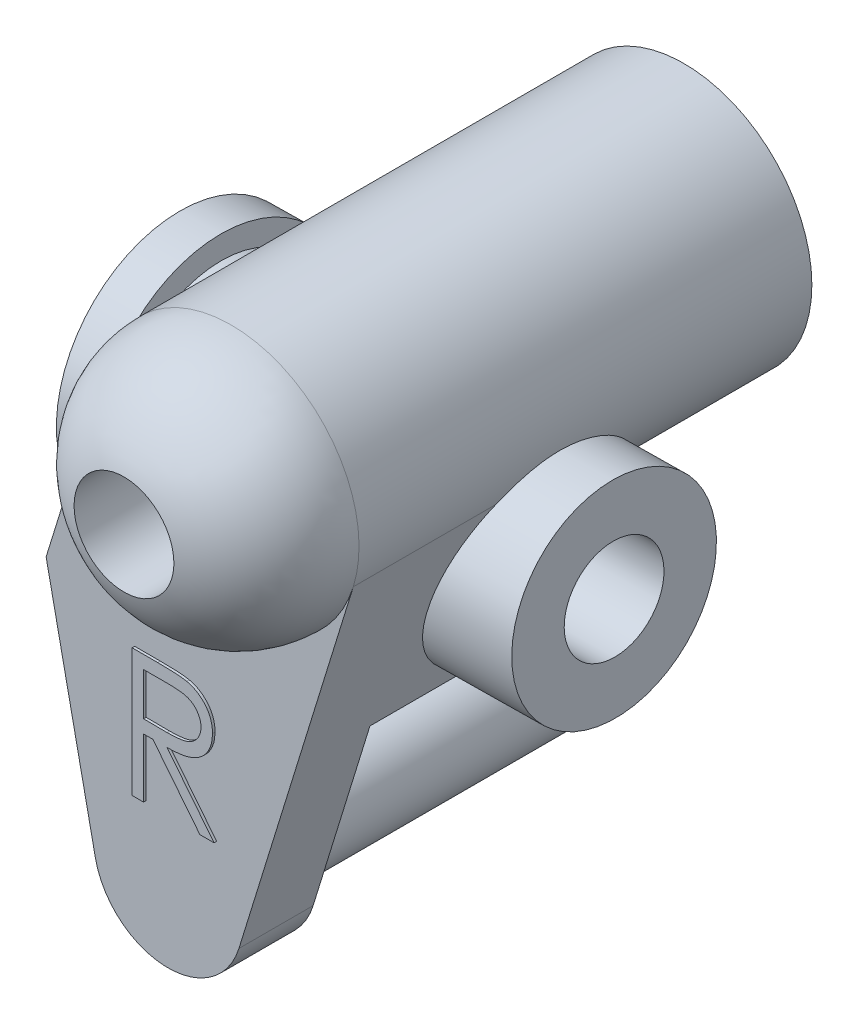
from build123d import *
from build123d.topology import SkipClean

# Parameters (mm, degrees)
BOSS_EXTRU_1_DEPTH      = 1.45
ESQUISSE2_R             = 2.5
BOSS_EXTRU_2_DEPTH      = 2.2
BOSS_EXTRU_3_START      = -11.05
ESQUISSE3_R             = 2.5
BOSS_EXTRU_3_DEPTH      = 11.05
BOSS_EXTRU_4_START      = -1.45
ESQUISSE4_R             = 0.95
BOSS_EXTRU_4_DEPTH      = 7.5
CONG_1_R                = 2.2
BOSS_EXTRU_5_DEPTH      = 1
BOSS_EXTRU_5_DEPTH_BACK = 7.454
ENL_V_START             = -6
ENL_V_MAT_EXTRU_2_DEPTH = 6
BOSS_EXTRU_6_DEPTH      = 1
BOSS_EXTRU_6_DEPTH_BACK = 7.45
ESQUISSE8_R             = 2
ESQUISSE9_R             = 2.45
BOSS_EXTRU_7_DEPTH      = 0.8
ENL_V_START_2           = -6.05
ESQUISSE10_R            = 3.6
ESQUISSE10_R_2          = 0.95
ENL_V_MAT_EXTRU_3_DEPTH = 6.05
ESQUISSE11_R            = 0.975
ENL_V_MAT_EXTRU_4_DEPTH = 14.8
ESQUISSE12_R            = 0.975
ENL_V_MAT_EXTRU_5_DEPTH = 14.8
BOSS_EXTRU_8_DEPTH      = 0.05
SCALE1_SCALE            = 6.5


with BuildPart() as part:
    # Esquisse1 → Boss.-Extru.1 (new body)
    with BuildSketch(Plane.XY):
        with BuildLine():
            Line((2.388668556, -0.737741507), (0.152544962, -7.977890074))
            ThreePointArc((0.152544962, -7.977890074), (-1.300802178, -8.998408422), (-2.652272655, -7.846365386))
            Line((-2.652272655, -7.846365386), (-3.615331703, -3.23396357))
            Line((-3.615331703, -3.23396357), (-2.388668556, 0.737741507))
            ThreePointArc((-2.388668556, 0.737741507), (0.737741507, 2.388668556), (2.388668556, -0.737741507))
        make_face()
    extrude(amount=BOSS_EXTRU_1_DEPTH)

    # Esquisse2 → Boss.-Extru.2 (add)
    with BuildSketch(Plane.XY.offset(1.45)):
        with Locations(Location((0, 0, 0), (0, 0, 162.836669811))):
            Circle(ESQUISSE2_R)
    extrude(amount=BOSS_EXTRU_2_DEPTH)

    # Esquisse3 → Boss.-Extru.3 (add)
    with BuildSketch(Plane.XY.offset(3.65).offset(BOSS_EXTRU_3_START)):
        Circle(ESQUISSE3_R)
    extrude(amount=BOSS_EXTRU_3_DEPTH)

    # Esquisse4 → Boss.-Extru.4 (add)
    with BuildSketch(Plane(origin=(0, 0, 0), x_dir=(-1, 0, 0), z_dir=(0, 0, -1)).offset(BOSS_EXTRU_4_START)):
        with Locations(Location((1.232882801, -7.55, 0), (0, 0, 180))):
            Circle(ESQUISSE4_R)
    extrude(amount=BOSS_EXTRU_4_DEPTH)

    # Congé1
    cong_1_edges = [part.edges().sort_by_distance(p)[0] for p in [
        (2.388668556, -0.737741507, 3.65),
    ]]
    fillet(cong_1_edges, radius=CONG_1_R - 0.0001)  # a hair under: the kernel refuses the full size

    # Esquisse5 → Boss.-Extru.5 (add, two sides: drawn at the far end of the back side and taken through both)
    with SkipClean():  # the faces are left unmerged after this step: merging them gives an invalid solid
        with BuildSketch(Plane(origin=(2.499733458, 0.03650531, 0), x_dir=(0, 0, -1), z_dir=(0.9998933833040308, 0.014602123983129264, 0)).offset(-BOSS_EXTRU_5_DEPTH_BACK)):
            with BuildLine():
                Line((2.5, -4.4), (0, -4.4))
                Line((0, -4.4), (0, 1.44275903))
                Line((0, 1.44275903), (2.5, 1.44275903))
                Line((2.5, 1.44275903), (2.5, -0.4))
                ThreePointArc((2.5, -0.4), (4.5, -2.4), (2.5, -4.4))
            make_face()
        extrude(amount=BOSS_EXTRU_5_DEPTH + BOSS_EXTRU_5_DEPTH_BACK)
    add(part.part.scale(1), mode=Mode.REPLACE)  # the faces are merged on a copy

    # Esquisse7 → Enlèv. mat.-Extru.2 (cut)
    with SkipClean():  # the faces are left unmerged after this step: merging them gives an invalid solid
        with BuildSketch(Plane.XY.offset(ENL_V_START)):
            with BuildLine():
                Line((-2.062527014, 1.412792382), (-4.974539167, 1.370266286))
                Line((-4.974539167, 1.370266286), (-4.889222475, -4.471869809))
                Line((-4.889222475, -4.471869809), (-3.361517986, -4.4495597))
                Line((-3.361517986, -4.4495597), (-3.615331703, -3.23396357))
                Line((-3.615331703, -3.23396357), (-2.388668556, 0.737741507))
                ThreePointArc((-2.388668556, 0.737741507), (-2.251046184, 1.087561988), (-2.062527014, 1.412792382))
            make_face()
            with BuildLine():
                Line((1.263130408, -4.38202281), (3.563876187, -4.348423453))
                Line((3.563876187, -4.348423453), (3.478559495, 1.493712642))
                Line((3.478559495, 1.493712642), (2.020392322, 1.472418034))
                ThreePointArc((2.020392322, 1.472418034), (2.46599995, 0.410906614), (2.388668556, -0.737741507))
                Line((2.388668556, -0.737741507), (1.263130408, -4.38202281))
            make_face()
        extrude(amount=ENL_V_MAT_EXTRU_2_DEPTH, mode=Mode.SUBTRACT)
    add(part.part.scale(1), mode=Mode.REPLACE)  # the faces are merged on a copy

    # Esquisse8 → Boss.-Extru.6 (add, two sides: drawn at the far end of the back side and taken through both)
    with BuildSketch(Plane(origin=(2.499733458, 0.03650531, 0), x_dir=(0, 0, -1), z_dir=(0.9998933833040308, 0.014602123983129264, 0)).offset(-BOSS_EXTRU_6_DEPTH_BACK)):
        with Locations(Location((2.5, -2.4, 0), (0, 0, 90))):
            Circle(ESQUISSE8_R)
    extrude(amount=BOSS_EXTRU_6_DEPTH + BOSS_EXTRU_6_DEPTH_BACK)

    # Esquisse9 → Boss.-Extru.7 (add)
    with BuildSketch(Plane(origin=(-4.949472247, -0.072280514, 0), x_dir=(0, 0, 1), z_dir=(-0.9998933833040308, -0.014602123983129264, 0))):
        with Locations(Location((-2.5, -2.4, 0), (0, 0, 270))):
            Circle(ESQUISSE9_R)
    extrude(amount=-BOSS_EXTRU_7_DEPTH)

    # Esquisse10 → Enlèv. mat.-Extru.3 (cut)
    with BuildSketch(Plane(origin=(0, 0, -6.05), x_dir=(-1, 0, 0), z_dir=(0, 0, -1)).offset(ENL_V_START_2)):
        with Locations((1.232882801, -7.55)):
            Circle(ESQUISSE10_R)
        with Locations(Location((1.232882801, -7.55, 0), (0, 0, 180))):
            Circle(ESQUISSE10_R_2, mode=Mode.SUBTRACT)
    extrude(amount=ENL_V_MAT_EXTRU_3_DEPTH, mode=Mode.SUBTRACT)

    # Esquisse11 → Enlèv. mat.-Extru.4 (cut)
    with BuildSketch(Plane(origin=(0, 0, -7.4), x_dir=(-1, 0, 0), z_dir=(0, 0, -1))):
        Circle(ESQUISSE11_R)
    extrude(amount=-ENL_V_MAT_EXTRU_4_DEPTH, mode=Mode.SUBTRACT)

    # Esquisse12 → Enlèv. mat.-Extru.5 (cut)
    with BuildSketch(Plane(origin=(-4.949472247, -0.072280514, 0), x_dir=(0, 0, 1), z_dir=(-0.9998933833040308, -0.014602123983129264, 0))):
        with Locations(Location((-2.5, -2.4, 0), (0, 0, 270))):
            Circle(ESQUISSE12_R)
    extrude(amount=-ENL_V_MAT_EXTRU_5_DEPTH, mode=Mode.SUBTRACT)

    # Esquisse13 → Boss.-Extru.8 (add)
    with BuildSketch(Plane.XY.offset(1.45)):
        with BuildLine():
            Line((-1.885288931, -3.882291157), (-1.38498845, -3.882291157))
            add(Edge.make_bspline(
                [(-1.38498845, -3.882291157), (-1.35160193, -3.88240229), (-1.287496112, -3.882615677), (-1.195658062, -3.883805508), (-1.112210136, -3.887215762), (-1.037195965, -3.890150464), (-0.970616925, -3.895501851), (-0.912268861, -3.900616599), (-0.862420505, -3.907312071), (-0.832244897, -3.91353023), (-0.8185822, -3.916345644)],
                knots=[0, 0, 0, 0, 1.410062039, 2.707475311, 3.878576406, 4.937260626, 5.877586885, 6.699081471, 7.410979367, 8, 8, 8, 8], degree=3))
            add(Edge.make_bspline(
                [(-0.8185822, -3.916345644), (-0.800291754, -3.920864762), (-0.764101047, -3.929806594), (-0.711993857, -3.948706308), (-0.662340769, -3.970577469), (-0.615348037, -3.996265841), (-0.571251044, -4.025962112), (-0.529595107, -4.059153628), (-0.490191205, -4.095658775), (-0.454632898, -4.136397947), (-0.421105004, -4.179138311), (-0.392827413, -4.22535528), (-0.368451356, -4.273684943), (-0.349043844, -4.324618813), (-0.33341672, -4.377662936), (-0.322397978, -4.43329779), (-0.315789987, -4.491269915), (-0.315117233, -4.530811279), (-0.31477611, -4.550860869)],
                knots=[0, 0, 0, 0, 1.027469482, 2.033020251, 3.019912614, 3.986113645, 4.951240523, 5.91722682, 6.890402269, 7.87763091, 8.8651537, 9.85103654, 10.82876324, 11.815024772, 12.821070561, 13.842952187, 14.906261191, 16, 16, 16, 16], degree=3))
            add(Edge.make_bspline(
                [(-0.31477611, -4.550860869), (-0.315825395, -4.584171658), (-0.31787282, -4.649169635), (-0.33696218, -4.743498836), (-0.368231123, -4.831491203), (-0.411319186, -4.913035945), (-0.46619024, -4.986543548), (-0.53213652, -5.051108159), (-0.609194814, -5.105136668), (-0.680930039, -5.142602957), (-0.744297325, -5.166597892), (-0.796463977, -5.183481006), (-0.853368961, -5.196525267), (-0.914467057, -5.208211075), (-0.980012525, -5.217033714), (-1.049848267, -5.223495567), (-1.12402409, -5.227534173), (-1.174980568, -5.228135605), (-1.20119438, -5.228445003)],
                knots=[0, 0, 0, 0, 1.260483769, 2.459530307, 3.627416485, 4.787058657, 5.939039949, 7.08810263, 8.267026773, 9.491475466, 10.141966685, 10.831826277, 11.566392101, 12.351337768, 13.187381173, 14.07005841, 15.007169909, 16, 16, 16, 16], degree=3))
            Line((-1.20119438, -5.228445003), (-0.282724828, -6.382291157))
            Line((-0.282724828, -6.382291157), (-0.560168739, -6.382291157))
            Line((-0.560168739, -6.382291157), (-1.47863829, -5.228445003))
            Line((-1.47863829, -5.228445003), (-1.660929956, -5.228445003))
            Line((-1.660929956, -5.228445003), (-1.660929956, -6.382291157))
            Line((-1.660929956, -6.382291157), (-1.885288931, -6.382291157))
            Line((-1.885288931, -6.382291157), (-1.885288931, -3.882291157))
        make_face()
        with BuildLine():
            Line((-1.660929956, -4.138701413), (-1.660929956, -4.972034747))
            Line((-1.660929956, -4.972034747), (-1.203197585, -4.975540356))
            add(Edge.make_bspline(
                [(-1.203197585, -4.975540356), (-1.181826128, -4.975549811), (-1.140402159, -4.975568137), (-1.080473113, -4.972715439), (-1.024673033, -4.969470212), (-0.973215353, -4.964506394), (-0.926077085, -4.9581092), (-0.883281789, -4.950107068), (-0.84475961, -4.940784166), (-0.799832082, -4.926354433), (-0.749663131, -4.903492992), (-0.69514066, -4.870231921), (-0.648710419, -4.828396836), (-0.609483374, -4.780558653), (-0.577962352, -4.727961333), (-0.555739456, -4.671235355), (-0.541637711, -4.611812785), (-0.539974464, -4.570971279), (-0.539135085, -4.550360067)],
                knots=[0, 0, 0, 0, 1.146690395, 2.22261258, 3.21895312, 4.145990853, 4.996080663, 5.770904154, 6.481378293, 7.121626537, 8.300444488, 9.431385265, 10.535395872, 11.636531494, 12.74115979, 13.810798291, 14.895190096, 16, 16, 16, 16], degree=3))
            add(Edge.make_bspline(
                [(-0.539135085, -4.550360067), (-0.539993743, -4.530255372), (-0.541695289, -4.490415201), (-0.555587267, -4.432089551), (-0.579079682, -4.37704173), (-0.610738423, -4.325495669), (-0.649309248, -4.278705858), (-0.694536257, -4.238672177), (-0.745182825, -4.205636845), (-0.792519396, -4.184526573), (-0.834829547, -4.171583821), (-0.871565019, -4.162475847), (-0.913073217, -4.155158369), (-0.959555688, -4.149295468), (-1.010813995, -4.144256222), (-1.067107318, -4.140862095), (-1.128062161, -4.138852192), (-1.170309969, -4.138752843), (-1.192179956, -4.138701413)],
                knots=[0, 0, 0, 0, 1.101028733, 2.181837193, 3.264309656, 4.369019818, 5.486613113, 6.575447106, 7.666700264, 8.788928104, 9.402425223, 10.0903467, 10.862060571, 11.710948788, 12.657782767, 13.684531032, 14.801375019, 16, 16, 16, 16], degree=3))
            Line((-1.192179956, -4.138701413), (-1.660929956, -4.138701413))
        make_face(mode=Mode.SUBTRACT)
    extrude(amount=BOSS_EXTRU_8_DEPTH)


with BuildPart() as part_1:
    # Scale1: scaled about (-0.519885651, -1.745435598, -1.884204612)
    add(part.part.scale(SCALE1_SCALE).moved(Location((2.85937108, 9.599895789, 10.363125366))))


solid = part_1.part
